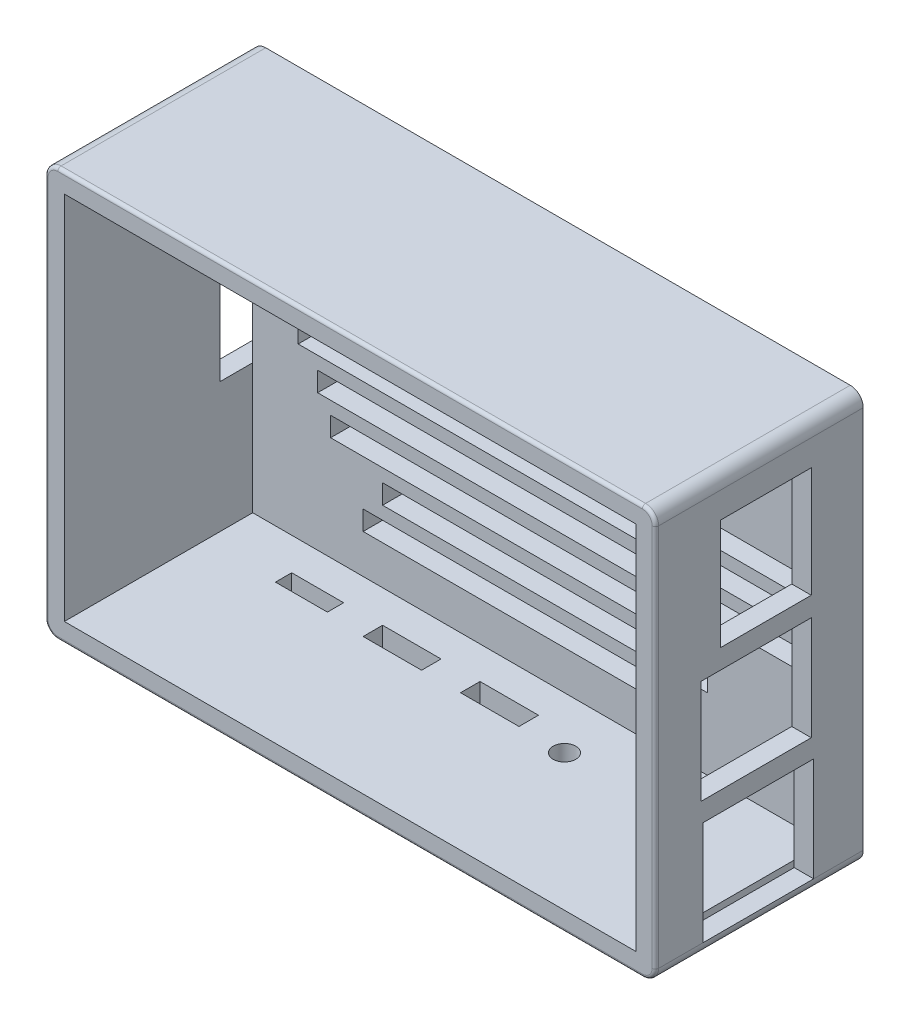
from build123d import *

# Parameters (mm, degrees)
SKETCH1_W             = 94
SKETCH1_H             = 63
BOSS_EXTRUDE1_DEPTH   = 32
SHELL1_T              = 3
SKETCH2_W             = 8
SKETCH2_H             = 17
CUT_EXTRUDE1_DEPTH    = 3
SKETCH3_W             = 14
SKETCH3_H             = 17
CUT_EXTRUDE2_DEPTH    = 3
SKETCH4_W             = 17
SKETCH4_H             = 16
CUT_EXTRUDE4_DEPTH    = 3
SKETCH5_W             = 17
SKETCH5_H             = 16
CUT_EXTRUDE5_DEPTH    = 3
SKETCH6_R             = 1.75
CUT_EXTRUDE6_DEPTH    = 3
SKETCH7_W             = 9
SKETCH7_H             = 3
SKETCH7_W_2           = 8
SKETCH7_H_2           = 2.5
CUT_EXTRUDE7_DEPTH    = 3
SKETCH9_W             = 2.320192308
SKETCH9_H             = 0.284935898
CUT_EXTRUDE8_DEPTH    = 1
SKETCH11_W            = 0.237446581
SKETCH11_H            = 2.645833333
SKETCH11_W_2          = 0.237446582
CUT_EXTRUDE9_DEPTH    = 1
SKETCH14_W            = 50
SKETCH14_H            = 3
SKETCH14_W_2          = 60
SKETCH14_W_3          = 76
CUT_EXTRUDE11_DEPTH   = 10
FILLET1_R             = 2
FILLET2_R             = 0.5
IZIM1_W               = 88
IZIM1_H               = 57
KES_EKSTR_ZYON1_DEPTH = 10


with BuildPart() as part:
    # Sketch1 → Boss-Extrude1 (new body)
    with BuildSketch(Plane.XY):
        with Locations((47, 31.5)):
            Rectangle(SKETCH1_W, SKETCH1_H)
    extrude(amount=BOSS_EXTRUDE1_DEPTH)

    # Shell1 (no face opened: a closed hollow body)
    add(offset(amount=-SHELL1_T, mode=Mode.PRIVATE), mode=Mode.SUBTRACT)

    # Sketch2 → Cut-Extrude1 (cut)
    with BuildSketch(Plane.ZY):
        with Locations((4, 31.5)):
            Rectangle(SKETCH2_W, SKETCH2_H)
    extrude(amount=-CUT_EXTRUDE1_DEPTH, mode=Mode.SUBTRACT)

    # Sketch3 → Cut-Extrude2 (cut)
    with BuildSketch(Plane(origin=(94, 0, 0), x_dir=(0, 0, -1), z_dir=(1, 0, 0))):
        with Locations((-15, 48.5)):
            Rectangle(SKETCH3_W, SKETCH3_H)
    extrude(amount=-CUT_EXTRUDE2_DEPTH, mode=Mode.SUBTRACT)

    # Sketch4 → Cut-Extrude4 (cut)
    with BuildSketch(Plane(origin=(94, 0, 0), x_dir=(0, 0, -1), z_dir=(1, 0, 0))):
        with Locations((-16.5, 29)):
            Rectangle(SKETCH4_W, SKETCH4_H)
    extrude(amount=-CUT_EXTRUDE4_DEPTH, mode=Mode.SUBTRACT)

    # Sketch5 → Cut-Extrude5 (cut)
    with BuildSketch(Plane(origin=(94, 0, 0), x_dir=(0, 0, -1), z_dir=(1, 0, 0))):
        with Locations((-16.132814298, 10)):
            Rectangle(SKETCH5_W, SKETCH5_H)
    extrude(amount=-CUT_EXTRUDE5_DEPTH, mode=Mode.SUBTRACT)

    # Sketch6 → Cut-Extrude6 (cut)
    with BuildSketch(Plane(origin=(0, 0, 0), x_dir=(-1, 0, 0), z_dir=(0, -1, 0))):
        with Locations(Location((-59, -11, 0), (0, 0, 90))):
            Circle(SKETCH6_R)
    extrude(amount=-CUT_EXTRUDE6_DEPTH, mode=Mode.SUBTRACT)

    # Sketch7 → Cut-Extrude7 (cut)
    with BuildSketch(Plane(origin=(0, 0, 0), x_dir=(-1, 0, 0), z_dir=(0, -1, 0))):
        with Locations((-47.5, -9.5)):
            Rectangle(SKETCH7_W, SKETCH7_H)
        with Locations((-32.5, -9.5)):
            Rectangle(SKETCH7_W, SKETCH7_H)
        with Locations((-18, -9.25)):
            Rectangle(SKETCH7_W_2, SKETCH7_H_2)
    extrude(amount=-CUT_EXTRUDE7_DEPTH, mode=Mode.SUBTRACT)

    # Sketch9 → Cut-Extrude8 (cut)
    # profile 1 of 8: a face of its own
    with BuildSketch(Plane.XY.offset(32)):
        with BuildLine():
            Line((79.592407853, 36.364576199), (79.401602564, 36.61389511))
            add(Edge.make_bspline(
                [(79.401602564, 36.61389511), (79.422798837, 36.631680451), (79.46490561, 36.667011349), (79.524032768, 36.723852197), (79.579427684, 36.783090116), (79.631354246, 36.844702462), (79.677996598, 36.909798235), (79.721785384, 36.976800531), (79.761035404, 37.046830186), (79.808626827, 37.143669259), (79.85828941, 37.270349808), (79.899930199, 37.42982084), (79.92643798, 37.596291622), (79.929308943, 37.709863731), (79.930769231, 37.767631087)],
                knots=[0, 0, 0, 0, 0.757959112, 1.505699292, 2.245454638, 2.979532153, 3.711538275, 4.438200793, 5.171680507, 5.909471876, 7.393775596, 8.890124382, 10.418191784, 12, 12, 12, 12], degree=3))
            add(Edge.make_bspline(
                [(79.930769231, 37.767631087), (79.930401126, 37.799456265), (79.929668331, 37.862811252), (79.920068742, 37.956840934), (79.906421017, 38.049292881), (79.886663101, 38.139823299), (79.860940087, 38.228252435), (79.830773858, 38.315253604), (79.793235048, 38.399802163), (79.751778443, 38.482915634), (79.704940099, 38.562540242), (79.653867717, 38.637894764), (79.599062564, 38.708634942), (79.54066611, 38.774956797), (79.477952603, 38.836132968), (79.411659795, 38.893143893), (79.340989768, 38.944962102), (79.267267879, 38.992860937), (79.190385773, 39.035482334), (79.1108271, 39.072287973), (79.028896043, 39.103833466), (78.944424761, 39.129026049), (78.857745669, 39.148897012), (78.768674814, 39.162624777), (78.677385087, 39.17213801), (78.615509579, 39.172864063), (78.584319912, 39.173230045)],
                knots=[0, 0, 0, 0, 1.055000685, 2.100209969, 3.131349012, 4.153242145, 5.170189196, 6.184191144, 7.204341339, 8.235672124, 9.263040994, 10.265373269, 11.252624173, 12.22887325, 13.193405896, 14.155809299, 15.126090485, 16.097288279, 17.069732292, 18.038585918, 19.002221264, 19.978698174, 20.959418239, 21.948869816, 22.966084182, 24, 24, 24, 24], degree=3))
            add(Edge.make_bspline(
                [(78.584319912, 39.173230045), (78.537392215, 39.172085395), (78.445255905, 39.169838027), (78.310299709, 39.149837038), (78.181013097, 39.119443134), (78.058204241, 39.073890432), (77.940358801, 39.017721007), (77.829470699, 38.946745595), (77.723864244, 38.864543451), (77.626035284, 38.769951656), (77.536669262, 38.666169237), (77.457974091, 38.554819346), (77.392374162, 38.436179314), (77.337785982, 38.311559085), (77.295824522, 38.179999681), (77.26628421, 38.041737682), (77.247014518, 37.897073801), (77.245169672, 37.798222988), (77.244230769, 37.747914541)],
                knots=[0, 0, 0, 0, 1.029171465, 2.020641659, 2.987623507, 3.938342917, 4.889210282, 5.84687017, 6.821220943, 7.821438502, 8.827599549, 9.822697543, 10.807740252, 11.797342354, 12.80366471, 13.83203677, 14.896651826, 16, 16, 16, 16], degree=3))
            add(Edge.make_bspline(
                [(77.244230769, 37.747914541), (77.245762734, 37.692485673), (77.248778006, 37.583388401), (77.274322468, 37.423397406), (77.315740722, 37.270239247), (77.373705266, 37.123905686), (77.449057348, 36.984809257), (77.540404709, 36.852732287), (77.648616268, 36.727563291), (77.731241677, 36.652296485), (77.773397436, 36.61389511)],
                knots=[0, 0, 0, 0, 1.028121516, 2.023589091, 2.998037872, 3.967518031, 4.937445131, 5.927275754, 6.942489185, 8, 8, 8, 8], degree=3))
            Line((77.773397436, 36.61389511), (77.5845002, 36.364576199))
            add(Edge.make_bspline(
                [(77.5845002, 36.364576199), (77.558611703, 36.384640458), (77.506958714, 36.424672869), (77.434141462, 36.489495894), (77.365646064, 36.557781681), (77.302039415, 36.630046279), (77.241993661, 36.705425405), (77.187521789, 36.785246822), (77.136964496, 36.868131861), (77.091284016, 36.95456309), (77.050326453, 37.044256744), (77.015748946, 37.13711948), (76.985534654, 37.232364561), (76.960842027, 37.330039952), (76.941538282, 37.430471959), (76.928641156, 37.533315999), (76.919803267, 37.638789163), (76.91899788, 37.709946769), (76.918589744, 37.746006488)],
                knots=[0, 0, 0, 0, 0.986756325, 1.968786143, 2.935506311, 3.899499537, 4.868307269, 5.8376204, 6.809456583, 7.792545619, 8.781780509, 9.778496008, 10.776623214, 11.79151764, 12.812666265, 13.856269958, 14.913646641, 16, 16, 16, 16], degree=3))
            add(Edge.make_bspline(
                [(76.918589744, 37.746006488), (76.918827408, 37.780154671), (76.919297361, 37.847678476), (76.926910255, 37.947372344), (76.937296803, 38.044427178), (76.952936064, 38.138565588), (76.971391287, 38.230301294), (76.996130213, 38.318802682), (77.023842671, 38.404940622), (77.056413623, 38.488369046), (77.093167589, 38.569158916), (77.134707074, 38.647049659), (77.180682766, 38.722005452), (77.23008124, 38.794763226), (77.284489221, 38.864248177), (77.343151096, 38.931062447), (77.405869149, 38.995580693), (77.451094623, 39.035497414), (77.473833133, 39.055566784)],
                knots=[0, 0, 0, 0, 1.114604814, 2.203992996, 3.262667896, 4.300477797, 5.318619304, 6.316056647, 7.298880507, 8.271930387, 9.238335007, 10.195173496, 11.151986948, 12.108099108, 13.064862484, 14.031167946, 15.010108607, 16, 16, 16, 16], degree=3))
            add(Edge.make_bspline(
                [(77.473833133, 39.055566784), (77.513331212, 39.087711975), (77.591850513, 39.151614272), (77.719109939, 39.233371142), (77.851977528, 39.303354996), (77.991151321, 39.359938867), (78.136319022, 39.404173632), (78.28755381, 39.434818002), (78.444714444, 39.454731243), (78.551609245, 39.457008433), (78.605944511, 39.458165943)],
                knots=[0, 0, 0, 0, 0.994628077, 1.977248131, 2.950237994, 3.925870899, 4.908910175, 5.911660606, 6.938484602, 8, 8, 8, 8], degree=3))
            add(Edge.make_bspline(
                [(78.605944511, 39.458165943), (78.663051712, 39.45674885), (78.775406564, 39.453960809), (78.94033561, 39.43046897), (79.098121922, 39.392219718), (79.249372626, 39.339550243), (79.393222321, 39.270065123), (79.530278547, 39.185947766), (79.660429392, 39.086376549), (79.782010866, 38.972601991), (79.893168603, 38.847802191), (79.990965005, 38.7141647), (80.072351404, 38.571940624), (80.140383692, 38.422699551), (80.19267544, 38.265323221), (80.229281549, 38.100147603), (80.252066361, 37.927483013), (80.254946728, 37.809679242), (80.256410256, 37.749822594)],
                knots=[0, 0, 0, 0, 1.032901378, 2.032168977, 3.007206631, 3.966850309, 4.924221947, 5.891988639, 6.871730993, 7.884084801, 8.900290346, 9.89161143, 10.874607481, 11.860025555, 12.854717796, 13.869097222, 14.917278314, 16, 16, 16, 16], degree=3))
            add(Edge.make_bspline(
                [(80.256410256, 37.749822594), (80.255973215, 37.713342251), (80.255108136, 37.641133087), (80.246661398, 37.534315646), (80.232605758, 37.430314869), (80.213348582, 37.328879244), (80.189745739, 37.229640947), (80.158847794, 37.133618086), (80.122967705, 37.040287782), (80.082697452, 36.949580136), (80.036659325, 36.862482019), (79.986657094, 36.779009281), (79.931536539, 36.70016887), (79.873119948, 36.624477791), (79.809222157, 36.55364009), (79.741924047, 36.48563266), (79.669228646, 36.422804733), (79.618061659, 36.384021241), (79.592407853, 36.364576199)],
                knots=[0, 0, 0, 0, 1.096705196, 2.170817488, 3.219277236, 4.250701065, 5.274195539, 6.284202015, 7.28098643, 8.279664616, 9.266225751, 10.241373748, 11.203306326, 12.157093976, 13.114198862, 14.069774147, 15.032234603, 16, 16, 16, 16], degree=3))
        make_face()
    # profile 2 of 8: a face of its own
    with BuildSketch(Plane.XY.offset(32)):
        with BuildLine():
            Line((79.320192308, 33.433806969), (77, 33.433806969))
            Line((77, 33.433806969), (77, 33.718742866))
            Line((77, 33.718742866), (77.401327123, 33.718742866))
            add(Edge.make_bspline(
                [(77.401327123, 33.718742866), (77.364995688, 33.75086605), (77.294094435, 33.813554849), (77.201743879, 33.918239121), (77.124780832, 34.028742835), (77.063197788, 34.145439663), (77.01658663, 34.267980451), (76.983808313, 34.396015744), (76.962470523, 34.529374903), (76.960362919, 34.62032125), (76.959294872, 34.666409132)],
                knots=[0, 0, 0, 0, 1.074295371, 2.096500925, 3.086030275, 4.053105238, 5.014108356, 5.985331429, 6.979048527, 8, 8, 8, 8], degree=3))
            add(Edge.make_bspline(
                [(76.959294872, 34.666409132), (76.960407182, 34.70738303), (76.962600707, 34.788185371), (76.979623451, 34.907045862), (77.006946428, 35.021435457), (77.044992597, 35.13142706), (77.095199127, 35.236275388), (77.155955963, 35.336571232), (77.227599005, 35.432548666), (77.309821196, 35.5223824), (77.399031733, 35.605211329), (77.494459932, 35.677678276), (77.594795087, 35.739096373), (77.700008999, 35.789571049), (77.810024757, 35.828631), (77.924766887, 35.855806157), (78.044044465, 35.872810557), (78.12526995, 35.875002971), (78.16645633, 35.876114661)],
                knots=[0, 0, 0, 0, 1.034036272, 2.039165313, 3.024406509, 3.999331371, 4.971254918, 5.953351348, 6.95522652, 7.989525907, 9.023492927, 10.024309745, 11.009187477, 11.988246066, 12.964946762, 13.950187958, 14.960617622, 16, 16, 16, 16], degree=3))
            add(Edge.make_bspline(
                [(78.16645633, 35.876114661), (78.206791433, 35.874978314), (78.286531756, 35.872731817), (78.403803519, 35.855988109), (78.516768542, 35.827853322), (78.625008361, 35.788294483), (78.728958893, 35.737792967), (78.827806828, 35.675318617), (78.92306426, 35.602877784), (79.011676453, 35.519163623), (79.093231565, 35.428523599), (79.165048714, 35.33200918), (79.225649774, 35.230823806), (79.274912545, 35.124764585), (79.314059741, 35.014582511), (79.341349107, 34.899440589), (79.357390885, 34.779862438), (79.359717355, 34.69868263), (79.360897436, 34.657504885)],
                knots=[0, 0, 0, 0, 1.02050356, 2.017480486, 2.990790918, 3.96161403, 4.928589988, 5.909588639, 6.91611943, 7.952353252, 8.989586576, 9.99823133, 10.991940466, 11.968822692, 12.952985106, 13.945868367, 14.958059758, 16, 16, 16, 16], degree=3))
            add(Edge.make_bspline(
                [(79.360897436, 34.657504885), (79.35959954, 34.610150313), (79.357054429, 34.517290231), (79.335648743, 34.381289209), (79.299929904, 34.252512878), (79.250839162, 34.130218955), (79.186088065, 34.014881847), (79.103669958, 33.907921046), (79.005467682, 33.807183259), (78.929818802, 33.748796176), (78.890880409, 33.718742866)],
                knots=[0, 0, 0, 0, 1.03879612, 2.037030165, 3.012306674, 3.966139504, 4.922386257, 5.905048148, 6.921675258, 8, 8, 8, 8], degree=3))
            Line((78.890880409, 33.718742866), (79.320192308, 33.718742866))
            Line((79.320192308, 33.718742866), (79.320192308, 33.433806969))
        make_face()
        with BuildLine():
            add(Edge.make_bspline(
                [(79.075961538, 34.653688779), (79.074479612, 34.695339668), (79.071554524, 34.777551898), (79.048718337, 34.898241451), (79.010723893, 35.013734268), (78.958757765, 35.123444511), (78.893429501, 35.225669681), (78.814353247, 35.316942945), (78.724043657, 35.398356292), (78.621741454, 35.465667444), (78.513319241, 35.522417441), (78.399120862, 35.561333849), (78.282314515, 35.587230091), (78.203058982, 35.589859112), (78.163276242, 35.591178763)],
                knots=[0, 0, 0, 0, 1.031093775, 2.03521511, 3.029845951, 4.035119871, 5.034286494, 6.024708811, 7.017619509, 8.03559408, 9.050082311, 10.039808432, 11.016071318, 12, 12, 12, 12], degree=3))
            add(Edge.make_bspline(
                [(78.163276242, 35.591178763), (78.123739082, 35.589471444), (78.044819734, 35.586063497), (77.927666339, 35.562016456), (77.813927693, 35.520351084), (77.704003595, 35.464896412), (77.601491403, 35.396075419), (77.509415819, 35.315337749), (77.430022437, 35.222900584), (77.363570151, 35.120453679), (77.31007922, 35.01120177), (77.272360445, 34.89625621), (77.248543069, 34.777636627), (77.245673038, 34.6968369), (77.244230769, 34.65623285)],
                knots=[0, 0, 0, 0, 0.979154363, 1.954470772, 2.947816011, 3.971783346, 4.997163654, 5.998045606, 6.995988793, 8.00538986, 9.015323546, 10.000094788, 10.994993517, 12, 12, 12, 12], degree=3))
            add(Edge.make_bspline(
                [(77.244230769, 34.65623285), (77.245714042, 34.615001481), (77.248656622, 34.53320494), (77.271874718, 34.412231326), (77.309396751, 34.294652065), (77.36210666, 34.182216186), (77.427132861, 34.077551449), (77.503594937, 33.983732822), (77.591774751, 33.903622309), (77.689464359, 33.836464479), (77.796058113, 33.78341316), (77.910031357, 33.745995378), (78.030488427, 33.723013869), (78.112927573, 33.720186219), (78.155008013, 33.718742866)],
                knots=[0, 0, 0, 0, 1.017484689, 2.018529338, 3.030031036, 4.058138743, 5.076350332, 6.065651025, 7.036469986, 8.00785331, 8.984076697, 9.96571663, 10.961615403, 12, 12, 12, 12], degree=3))
            add(Edge.make_bspline(
                [(78.155008013, 33.718742866), (78.187064461, 33.719613425), (78.250161695, 33.721326961), (78.34280612, 33.734417353), (78.431463925, 33.75524147), (78.516232148, 33.784581448), (78.596628012, 33.823136852), (78.67328171, 33.869589193), (78.745479223, 33.924891278), (78.813129118, 33.987360122), (78.874523952, 34.056508928), (78.928636843, 34.130039722), (78.974431239, 34.2077675), (79.011078734, 34.289637702), (79.040934529, 34.375019758), (79.060653765, 34.464732039), (79.074237276, 34.557870409), (79.075380733, 34.621413033), (79.075961538, 34.653688779)],
                knots=[0, 0, 0, 0, 1.050062701, 2.066855696, 3.059271411, 4.030305351, 4.999747758, 5.975466543, 6.961907836, 7.974539719, 8.98812422, 9.98710676, 10.961662635, 11.93785114, 12.922015094, 13.919620009, 14.94329489, 16, 16, 16, 16], degree=3))
        make_face(mode=Mode.SUBTRACT)
    # profile 3 of 8: a face of its own
    with BuildSketch(Plane.XY.offset(32)):
        with BuildLine():
            Line((79.320192308, 32.782524917), (79.320192308, 32.49758902))
            Line((79.320192308, 32.49758902), (78.901692708, 32.49758902))
            add(Edge.make_bspline(
                [(78.901692708, 32.49758902), (78.939650035, 32.467165594), (79.013307553, 32.408127874), (79.11011836, 32.3098078), (79.189897243, 32.205900119), (79.253491399, 32.097041159), (79.301430838, 31.983083142), (79.33605279, 31.864720712), (79.356812599, 31.741245228), (79.359525165, 31.657276061), (79.360897436, 31.614796552)],
                knots=[0, 0, 0, 0, 1.12780773, 2.188550248, 3.19190651, 4.159438251, 5.104880172, 6.052711206, 7.014878035, 8, 8, 8, 8], degree=3))
            add(Edge.make_bspline(
                [(79.360897436, 31.614796552), (79.359311939, 31.571862065), (79.356208739, 31.487828919), (79.331733941, 31.365458896), (79.289686849, 31.25106759), (79.232671944, 31.144905591), (79.161388453, 31.049412476), (79.077897152, 30.966307542), (78.982598051, 30.896985598), (78.893915897, 30.850576457), (78.815281557, 30.819977568), (78.747928028, 30.800717955), (78.67289119, 30.784360928), (78.590395887, 30.770180807), (78.499864703, 30.760585823), (78.401668573, 30.753018182), (78.295839357, 30.74759465), (78.222645059, 30.747379469), (78.184900841, 30.747268507)],
                knots=[0, 0, 0, 0, 1.235764744, 2.418689688, 3.575570385, 4.733739044, 5.876600945, 6.994686206, 8.113221397, 9.257403329, 9.866223892, 10.540462211, 11.272173464, 12.077110251, 12.949508505, 13.892531187, 14.913238277, 16, 16, 16, 16], degree=3))
            Line((78.184900841, 30.747268507), (77, 30.747268507))
            Line((77, 30.747268507), (77, 31.032204404))
            Line((77, 31.032204404), (78.09140625, 31.032204404))
            add(Edge.make_bspline(
                [(78.09140625, 31.032204404), (78.122995182, 31.032379672), (78.183419433, 31.032714928), (78.269932762, 31.033772336), (78.348388443, 31.036321232), (78.418598912, 31.039902916), (78.48049675, 31.045145322), (78.534208022, 31.050608709), (78.579664536, 31.057289795), (78.607028575, 31.063243295), (78.619300881, 31.065913339)],
                knots=[0, 0, 0, 0, 1.430800155, 2.736877192, 3.918605307, 4.986035426, 5.920637409, 6.731861385, 7.431261377, 8, 8, 8, 8], degree=3))
            add(Edge.make_bspline(
                [(78.619300881, 31.065913339), (78.655324599, 31.075552214), (78.72465911, 31.094104066), (78.818706559, 31.139945608), (78.898714915, 31.197834186), (78.964189512, 31.268498664), (79.015144486, 31.351256468), (79.05049943, 31.445877948), (79.072612189, 31.55145), (79.074813944, 31.625703619), (79.075961538, 31.664405927)],
                knots=[0, 0, 0, 0, 1.084156227, 2.086665306, 3.027808233, 3.945421172, 4.874247719, 5.839848303, 6.874090471, 8, 8, 8, 8], degree=3))
            add(Edge.make_bspline(
                [(79.075961538, 31.664405927), (79.075529895, 31.687327406), (79.074675684, 31.732688421), (79.066099662, 31.799951868), (79.052085413, 31.86520175), (79.033122211, 31.929066782), (79.007317289, 31.990192218), (78.977447743, 32.050364303), (78.940871435, 32.107861022), (78.899887182, 32.163769838), (78.85421131, 32.215723112), (78.806720377, 32.264756865), (78.755415002, 32.307838312), (78.702111953, 32.346944432), (78.645739749, 32.380660736), (78.586901169, 32.41010292), (78.525503092, 32.435081034), (78.482890095, 32.447493284), (78.46156851, 32.453703804)],
                knots=[0, 0, 0, 0, 1.02388931, 2.02625049, 3.024079426, 4.004119353, 4.998163158, 5.985366248, 7.002659681, 8.039138713, 9.080111048, 10.09169763, 11.086418407, 12.069932368, 13.043171485, 14.017654831, 15.008125612, 16, 16, 16, 16], degree=3))
            add(Edge.make_bspline(
                [(78.46156851, 32.453703804), (78.445915575, 32.457277628), (78.411839956, 32.465057656), (78.355919662, 32.473460683), (78.291231327, 32.481087555), (78.21785044, 32.487471082), (78.135520082, 32.49137671), (78.044591857, 32.495635198), (77.944703193, 32.497185561), (77.875160086, 32.497450767), (77.838907252, 32.49758902)],
                knots=[0, 0, 0, 0, 0.615963638, 1.340920617, 2.168419149, 3.115676021, 4.16674242, 5.331190069, 6.6087489, 8, 8, 8, 8], degree=3))
            Line((77.838907252, 32.49758902), (77, 32.49758902))
            Line((77, 32.49758902), (77, 32.782524917))
            Line((77, 32.782524917), (79.320192308, 32.782524917))
        make_face()
    # profile 4 of 8: a face of its own
    with BuildSketch(Plane.XY.offset(32)):
        with BuildLine():
            Line((79.320192308, 27.73508902), (77, 27.73508902))
            Line((77, 27.73508902), (77, 28.020024917))
            Line((77, 28.020024917), (77.401327123, 28.020024917))
            add(Edge.make_bspline(
                [(77.401327123, 28.020024917), (77.364995688, 28.052148102), (77.294094435, 28.1148369), (77.201743879, 28.219521173), (77.124780832, 28.330024887), (77.063197788, 28.446721714), (77.01658663, 28.569262502), (76.983808313, 28.697297795), (76.962470523, 28.830656954), (76.960362919, 28.921603301), (76.959294872, 28.967691183)],
                knots=[0, 0, 0, 0, 1.074295371, 2.096500925, 3.086030275, 4.053105238, 5.014108356, 5.985331429, 6.979048527, 8, 8, 8, 8], degree=3))
            add(Edge.make_bspline(
                [(76.959294872, 28.967691183), (76.960407182, 29.008665081), (76.962600707, 29.089467423), (76.979623451, 29.208327913), (77.006946428, 29.322717508), (77.044992597, 29.432709111), (77.095199127, 29.537557439), (77.155955963, 29.637853283), (77.227599005, 29.733830718), (77.309821196, 29.823664452), (77.399031733, 29.90649338), (77.494459932, 29.978960327), (77.594795087, 30.040378424), (77.700008999, 30.0908531), (77.810024757, 30.129913051), (77.924766887, 30.157088208), (78.044044465, 30.174092608), (78.12526995, 30.176285022), (78.16645633, 30.177396712)],
                knots=[0, 0, 0, 0, 1.034036272, 2.039165313, 3.024406509, 3.999331371, 4.971254918, 5.953351348, 6.95522652, 7.989525907, 9.023492927, 10.024309745, 11.009187477, 11.988246066, 12.964946762, 13.950187958, 14.960617622, 16, 16, 16, 16], degree=3))
            add(Edge.make_bspline(
                [(78.16645633, 30.177396712), (78.206791433, 30.176260365), (78.286531756, 30.174013868), (78.403803519, 30.15727016), (78.516768542, 30.129135373), (78.625008361, 30.089576534), (78.728958893, 30.039075018), (78.827806828, 29.976600669), (78.92306426, 29.904159835), (79.011676453, 29.820445675), (79.093231565, 29.72980565), (79.165048714, 29.633291232), (79.225649774, 29.532105857), (79.274912545, 29.426046637), (79.314059741, 29.315864562), (79.341349107, 29.20072264), (79.357390885, 29.081144489), (79.359717355, 28.999964681), (79.360897436, 28.958786937)],
                knots=[0, 0, 0, 0, 1.02050356, 2.017480486, 2.990790918, 3.96161403, 4.928589988, 5.909588639, 6.91611943, 7.952353252, 8.989586576, 9.99823133, 10.991940466, 11.968822692, 12.952985106, 13.945868367, 14.958059758, 16, 16, 16, 16], degree=3))
            add(Edge.make_bspline(
                [(79.360897436, 28.958786937), (79.35959954, 28.911432364), (79.357054429, 28.818572282), (79.335648743, 28.68257126), (79.299929904, 28.55379493), (79.250839162, 28.431501006), (79.186088065, 28.316163898), (79.103669958, 28.209203097), (79.005467682, 28.10846531), (78.929818802, 28.050078227), (78.890880409, 28.020024917)],
                knots=[0, 0, 0, 0, 1.03879612, 2.037030165, 3.012306674, 3.966139504, 4.922386257, 5.905048148, 6.921675258, 8, 8, 8, 8], degree=3))
            Line((78.890880409, 28.020024917), (79.320192308, 28.020024917))
            Line((79.320192308, 28.020024917), (79.320192308, 27.73508902))
        make_face()
        with BuildLine():
            add(Edge.make_bspline(
                [(79.075961538, 28.954970831), (79.074479612, 28.996621719), (79.071554524, 29.078833949), (79.048718337, 29.199523503), (79.010723893, 29.315016319), (78.958757765, 29.424726562), (78.893429501, 29.526951732), (78.814353247, 29.618224996), (78.724043657, 29.699638344), (78.621741454, 29.766949495), (78.513319241, 29.823699492), (78.399120862, 29.862615901), (78.282314515, 29.888512142), (78.203058982, 29.891141163), (78.163276242, 29.892460815)],
                knots=[0, 0, 0, 0, 1.031093775, 2.03521511, 3.029845951, 4.035119871, 5.034286494, 6.024708811, 7.017619509, 8.03559408, 9.050082311, 10.039808432, 11.016071318, 12, 12, 12, 12], degree=3))
            add(Edge.make_bspline(
                [(78.163276242, 29.892460815), (78.123739082, 29.890753495), (78.044819734, 29.887345549), (77.927666339, 29.863298507), (77.813927693, 29.821633136), (77.704003595, 29.766178463), (77.601491403, 29.69735747), (77.509415819, 29.616619801), (77.430022437, 29.524182636), (77.363570151, 29.421735731), (77.31007922, 29.312483821), (77.272360445, 29.197538261), (77.248543069, 29.078918679), (77.245673038, 28.998118951), (77.244230769, 28.957514901)],
                knots=[0, 0, 0, 0, 0.979154363, 1.954470772, 2.947816011, 3.971783346, 4.997163654, 5.998045606, 6.995988793, 8.00538986, 9.015323546, 10.000094788, 10.994993517, 12, 12, 12, 12], degree=3))
            add(Edge.make_bspline(
                [(77.244230769, 28.957514901), (77.245714042, 28.916283532), (77.248656622, 28.834486992), (77.271874718, 28.713513377), (77.309396751, 28.595934116), (77.36210666, 28.483498238), (77.427132861, 28.3788335), (77.503594937, 28.285014874), (77.591774751, 28.20490436), (77.689464359, 28.137746531), (77.796058113, 28.084695211), (77.910031357, 28.047277429), (78.030488427, 28.024295921), (78.112927573, 28.02146827), (78.155008013, 28.020024917)],
                knots=[0, 0, 0, 0, 1.017484689, 2.018529338, 3.030031036, 4.058138743, 5.076350332, 6.065651025, 7.036469986, 8.00785331, 8.984076697, 9.96571663, 10.961615403, 12, 12, 12, 12], degree=3))
            add(Edge.make_bspline(
                [(78.155008013, 28.020024917), (78.187064461, 28.020895476), (78.250161695, 28.022609012), (78.34280612, 28.035699404), (78.431463925, 28.056523521), (78.516232148, 28.085863499), (78.596628012, 28.124418903), (78.67328171, 28.170871244), (78.745479223, 28.226173329), (78.813129118, 28.288642174), (78.874523952, 28.35779098), (78.928636843, 28.431321773), (78.974431239, 28.509049551), (79.011078734, 28.590919753), (79.040934529, 28.676301809), (79.060653765, 28.76601409), (79.074237276, 28.85915246), (79.075380733, 28.922695085), (79.075961538, 28.954970831)],
                knots=[0, 0, 0, 0, 1.050062701, 2.066855696, 3.059271411, 4.030305351, 4.999747758, 5.975466543, 6.961907836, 7.974539719, 8.98812422, 9.98710676, 10.961662635, 11.93785114, 12.922015094, 13.919620009, 14.94329489, 16, 16, 16, 16], degree=3))
        make_face(mode=Mode.SUBTRACT)
    # profile 5 of 8: a face of its own
    with BuildSketch(Plane.XY.offset(32)):
        Polygon((80.175, 27.002396712), (80.175, 26.717460815), (78.965930489, 26.717460815), (80.175, 25.39390813), (80.175, 24.987492866), (78.750320513, 26.547644108), (77, 24.865377481), (77, 25.245080005), (78.532166466, 26.717460815), (77, 26.717460815), (77, 27.002396712), align=None)
    # profile 6 of 8: a face of its own
    with BuildSketch(Plane.XY.offset(32)):
        with BuildLine():
            add(Edge.make_bspline(
                [(80.297115385, 24.378187978), (80.296291631, 24.360509523), (80.294678565, 24.325891711), (80.280975474, 24.275781599), (80.257393594, 24.230198762), (80.226783738, 24.189164526), (80.189305024, 24.15514903), (80.146720919, 24.13075811), (80.100361492, 24.11518702), (80.068059231, 24.113295616), (80.05161258, 24.11233261)],
                knots=[0, 0, 0, 0, 1.054986045, 2.065865298, 3.074122704, 4.105114675, 5.109626121, 6.074217918, 7.019490725, 8, 8, 8, 8], degree=3))
            add(Edge.make_bspline(
                [(80.05161258, 24.11233261), (80.035592833, 24.113317159), (80.003923688, 24.115263496), (79.958368075, 24.130746599), (79.916376945, 24.155353519), (79.878971504, 24.189141886), (79.848379332, 24.230204742), (79.82479278, 24.275780017), (79.811090923, 24.325892127), (79.809477686, 24.360509663), (79.808653846, 24.378187978)],
                knots=[0, 0, 0, 0, 0.961106377, 1.899993565, 2.859409042, 3.870007927, 4.90724781, 5.921615355, 6.938620636, 8, 8, 8, 8], degree=3))
            add(Edge.make_bspline(
                [(79.808653846, 24.378187978), (79.809451227, 24.395663254), (79.811003226, 24.429676594), (79.824956711, 24.478865329), (79.848328041, 24.523714721), (79.879394858, 24.564077894), (79.916128223, 24.598536163), (79.958399793, 24.623052291), (80.003915612, 24.638576791), (80.03559012, 24.640517549), (80.05161258, 24.641499276)],
                knots=[0, 0, 0, 0, 1.055304112, 2.054011575, 3.063363921, 4.096942562, 5.122536081, 6.088009498, 7.032825006, 8, 8, 8, 8], degree=3))
            add(Edge.make_bspline(
                [(80.05161258, 24.641499276), (80.068062047, 24.640539197), (80.100369838, 24.638653541), (80.146688658, 24.623040241), (80.189555867, 24.598743174), (80.226360691, 24.564055629), (80.257444772, 24.52372055), (80.280811588, 24.478863811), (80.294766253, 24.429676997), (80.296318087, 24.39566339), (80.297115385, 24.378187978)],
                knots=[0, 0, 0, 0, 0.986662878, 1.937868148, 2.908513651, 3.927890639, 4.955204348, 5.958438607, 6.951092507, 8, 8, 8, 8], degree=3))
        make_face()
    # profile 7 of 8: a face of its own
    with BuildSketch(Plane.XY.offset(32)):
        with Locations((78.160096154, 24.376915943)):
            Rectangle(SKETCH9_W, SKETCH9_H)
    # profile 8 of 8: a face of its own
    with BuildSketch(Plane.XY.offset(32)):
        Polygon((80.256410256, 23.298230045), (80.256410256, 23.013294148), (79.320192308, 23.013294148), (79.320192308, 22.606242866), (79.03525641, 22.606242866), (79.03525641, 23.013294148), (77, 23.013294148), (77, 23.298230045), (79.03525641, 23.298230045), (79.03525641, 23.705281328), (79.320192308, 23.705281328), (79.320192308, 23.298230045), align=None)
    extrude(amount=-CUT_EXTRUDE8_DEPTH, mode=Mode.SUBTRACT)

    # Sketch11 → Cut-Extrude9 (cut)
    # profile 1 of 14: a face of its own
    with BuildSketch(Plane.XZ):
        with BuildLine():
            Line((13.568376068, 2.645833333), (14.08726045, 2.645833333))
            add(Edge.make_bspline(
                [(14.08726045, 2.645833333), (14.122949647, 2.645794102), (14.191331733, 2.645718934), (14.289390138, 2.643439929), (14.378448686, 2.640395942), (14.458315343, 2.636176297), (14.529235845, 2.631189588), (14.59088928, 2.624195487), (14.643760254, 2.616892764), (14.675439534, 2.609468248), (14.689887153, 2.606082232)],
                knots=[0, 0, 0, 0, 1.415646017, 2.712440637, 3.8905458, 4.950247383, 5.884950622, 6.709939814, 7.411656543, 8, 8, 8, 8], degree=3))
            add(Edge.make_bspline(
                [(14.689887153, 2.606082232), (14.708176312, 2.601076353), (14.74432367, 2.591182553), (14.796409578, 2.571366226), (14.845965163, 2.547869589), (14.893160448, 2.521090777), (14.937415476, 2.489880857), (14.979390518, 2.455504967), (15.018715146, 2.417169436), (15.055168222, 2.375304234), (15.088645421, 2.330612171), (15.117469645, 2.28242608), (15.141605108, 2.231557059), (15.162305558, 2.178040491), (15.177204211, 2.121426972), (15.18842776, 2.062109874), (15.195551574, 2.000095555), (15.196233867, 1.957716964), (15.196581197, 1.936143663)],
                knots=[0, 0, 0, 0, 0.999701418, 1.975846123, 2.934577507, 3.890451536, 4.834027766, 5.787354733, 6.749476667, 7.726910423, 8.712836071, 9.690891519, 10.682875813, 11.679750201, 12.712814741, 13.765529915, 14.8625177, 16, 16, 16, 16], degree=3))
            add(Edge.make_bspline(
                [(15.196581197, 1.936143663), (15.19626262, 1.914389034), (15.195639302, 1.871824634), (15.188158182, 1.809554728), (15.178081192, 1.750047374), (15.162586396, 1.693434515), (15.142292346, 1.640052356), (15.118485853, 1.589085115), (15.089772113, 1.541399887), (15.0567787, 1.496823554), (15.020076007, 1.455314275), (14.979819321, 1.417172853), (14.936171166, 1.382622549), (14.889270256, 1.351585908), (14.838659358, 1.32478265), (14.785106064, 1.300775639), (14.728144888, 1.280613587), (14.688727631, 1.270007529), (14.668686565, 1.264615051)],
                knots=[0, 0, 0, 0, 1.121902311, 2.195077645, 3.232258892, 4.234102512, 5.217864754, 6.176164875, 7.132989551, 8.084763148, 9.034132444, 9.988522005, 10.94243251, 11.903244335, 12.886203696, 13.894208494, 14.929344452, 16, 16, 16, 16], degree=3))
            add(Edge.make_bspline(
                [(14.668686565, 1.264615051), (14.652110545, 1.261090059), (14.615783232, 1.253364835), (14.555955103, 1.244740585), (14.486297579, 1.237379422), (14.406905737, 1.23186011), (14.317850838, 1.227135129), (14.219084709, 1.223379487), (14.110413472, 1.221315847), (14.034613187, 1.221209415), (13.995037894, 1.221153846)],
                knots=[0, 0, 0, 0, 0.601384939, 1.31797006, 2.144135048, 3.087295005, 4.142315834, 5.309527816, 6.595305764, 8, 8, 8, 8], degree=3))
            Line((13.995037894, 1.221153846), (13.80582265, 1.221153846))
            Line((13.80582265, 1.221153846), (13.80582265, 0))
            Line((13.80582265, 0), (13.568376068, 0))
            Line((13.568376068, 0), (13.568376068, 2.645833333))
        make_face()
        with BuildLine():
            Line((13.80582265, 2.374465812), (13.80582265, 1.492521368))
            Line((13.80582265, 1.492521368), (14.269055489, 1.486691206))
            add(Edge.make_bspline(
                [(14.269055489, 1.486691206), (14.291673528, 1.486679516), (14.335337186, 1.486656949), (14.398410998, 1.489669589), (14.456928733, 1.493147372), (14.510710644, 1.49823941), (14.559780975, 1.505437027), (14.604221548, 1.512703043), (14.643687768, 1.523214835), (14.689875855, 1.537368584), (14.741343623, 1.56150812), (14.797335163, 1.59654643), (14.844786737, 1.641208632), (14.885848783, 1.69142491), (14.918434774, 1.747289132), (14.942289602, 1.807061483), (14.956305834, 1.870128965), (14.958185278, 1.913284879), (14.959134615, 1.935083634)],
                knots=[0, 0, 0, 0, 1.160613943, 2.240541288, 3.23993089, 4.169200891, 5.011653406, 5.7853311, 6.478053781, 7.106038997, 8.262395093, 9.384106736, 10.481365981, 11.59014053, 12.70357646, 13.786202915, 14.881775077, 16, 16, 16, 16], degree=3))
            add(Edge.make_bspline(
                [(14.959134615, 1.935083634), (14.958180115, 1.95635501), (14.956282686, 1.998639873), (14.942179741, 2.060611913), (14.918481153, 2.11975438), (14.885630037, 2.174918557), (14.845760254, 2.224954141), (14.79942087, 2.268419231), (14.746720964, 2.303360638), (14.697698789, 2.325913178), (14.654155036, 2.339683059), (14.616333256, 2.349317551), (14.573628996, 2.357009825), (14.526028354, 2.363238497), (14.473900271, 2.368570577), (14.416796902, 2.372188548), (14.354934564, 2.374306316), (14.311988478, 2.374411359), (14.289726062, 2.374465812)],
                knots=[0, 0, 0, 0, 1.120700087, 2.227813068, 3.331159281, 4.466773991, 5.599788987, 6.693661531, 7.80175334, 8.91857717, 9.525282508, 10.207424825, 10.974604443, 11.810962634, 12.737642355, 13.736264703, 14.826523623, 16, 16, 16, 16], degree=3))
            Line((14.289726062, 2.374465812), (13.80582265, 2.374465812))
        make_face(mode=Mode.SUBTRACT)
    # profile 2 of 14: a face of its own
    with BuildSketch(Plane.XZ):
        Polygon((15.569711538, 2.645833333), (15.81510834, 2.645833333), (16.332932692, 0.705449553), (17.103044037, 2.645833333), (17.137494992, 2.645833333), (17.89329594, 0.71869992), (18.413770366, 2.645833333), (18.656517094, 2.645833333), (17.943117321, 0), (17.909196381, 0), (17.113114316, 2.023596087), (16.307491987, 0), (16.273571047, 0), align=None)
    # profile 3 of 14: a face of its own
    with BuildSketch(Plane.XZ):
        with BuildLine():
            Line((19.131410256, 2.645833333), (19.660894932, 2.645833333))
            add(Edge.make_bspline(
                [(19.660894932, 2.645833333), (19.696228999, 2.645715718), (19.764074323, 2.645489883), (19.861269593, 2.644230645), (19.949585315, 2.64062146), (20.028975312, 2.637515566), (20.099438129, 2.631852015), (20.161189831, 2.626438907), (20.213946007, 2.619352866), (20.245881859, 2.612771981), (20.260341546, 2.609792334)],
                knots=[0, 0, 0, 0, 1.410062039, 2.707475311, 3.878576406, 4.937260626, 5.877586885, 6.699081471, 7.410979367, 8, 8, 8, 8], degree=3))
            add(Edge.make_bspline(
                [(20.260341546, 2.609792334), (20.279698935, 2.605009601), (20.318000766, 2.595546163), (20.373147542, 2.575543965), (20.425697061, 2.552396987), (20.475431035, 2.525210127), (20.522100354, 2.493781573), (20.56618622, 2.458653885), (20.607888683, 2.420019271), (20.645521225, 2.376903647), (20.681004913, 2.331670095), (20.710932029, 2.282757136), (20.736730023, 2.231608243), (20.75726964, 2.177703231), (20.773808346, 2.121564868), (20.785469848, 2.062684646), (20.792463306, 2.001330814), (20.793175304, 1.959482871), (20.793536325, 1.938263722)],
                knots=[0, 0, 0, 0, 1.027469482, 2.033020251, 3.019912614, 3.986113645, 4.951240523, 5.91722682, 6.890402269, 7.87763091, 8.8651537, 9.85103654, 10.82876324, 11.815024772, 12.821070561, 13.842952187, 14.906261191, 16, 16, 16, 16], degree=3))
            add(Edge.make_bspline(
                [(20.793536325, 1.938263722), (20.792425832, 1.903009804), (20.790258973, 1.834220278), (20.770056068, 1.73438854), (20.736963103, 1.641263284), (20.691361569, 1.554961766), (20.633289704, 1.477166219), (20.563496558, 1.408835339), (20.481943197, 1.351655167), (20.406023417, 1.312003345), (20.338959706, 1.286608705), (20.283749999, 1.268740744), (20.223525558, 1.254935567), (20.158863406, 1.242568087), (20.089494453, 1.233230794), (20.015584958, 1.226391999), (19.937082213, 1.222117808), (19.883153274, 1.221481292), (19.855410323, 1.221153846)],
                knots=[0, 0, 0, 0, 1.260483769, 2.459530307, 3.627416485, 4.787058657, 5.939039949, 7.08810263, 8.267026773, 9.491475466, 10.141966685, 10.831826277, 11.566392101, 12.351337768, 13.187381173, 14.07005841, 15.007169909, 16, 16, 16, 16], degree=3))
            Line((19.855410323, 1.221153846), (20.827457265, 0))
            Line((20.827457265, 0), (20.533829127, 0))
            Line((20.533829127, 0), (19.561782185, 1.221153846))
            Line((19.561782185, 1.221153846), (19.368856838, 1.221153846))
            Line((19.368856838, 1.221153846), (19.368856838, 0))
            Line((19.368856838, 0), (19.131410256, 0))
            Line((19.131410256, 0), (19.131410256, 2.645833333))
        make_face()
        with BuildLine():
            Line((19.368856838, 2.374465812), (19.368856838, 1.492521368))
            Line((19.368856838, 1.492521368), (19.853290264, 1.488811265))
            add(Edge.make_bspline(
                [(19.853290264, 1.488811265), (19.875908389, 1.488801258), (19.919748757, 1.488781863), (19.983173664, 1.491800968), (20.042228748, 1.4952355), (20.096688127, 1.500488875), (20.146576127, 1.507259238), (20.191867814, 1.515728161), (20.232637121, 1.525594899), (20.280185421, 1.540866366), (20.333280894, 1.565061392), (20.390983843, 1.600262691), (20.440122515, 1.644538156), (20.481637804, 1.6951669), (20.514997553, 1.750832398), (20.538516784, 1.810867391), (20.553441131, 1.873756277), (20.5552014, 1.916980204), (20.556089744, 1.938793737)],
                knots=[0, 0, 0, 0, 1.146690395, 2.22261258, 3.21895312, 4.145990853, 4.996080663, 5.770904154, 6.481378293, 7.121626537, 8.300444488, 9.431385265, 10.535395872, 11.636531494, 12.74115979, 13.810798291, 14.895190096, 16, 16, 16, 16], degree=3))
            add(Edge.make_bspline(
                [(20.556089744, 1.938793737), (20.555180997, 1.960071206), (20.553380194, 2.002235387), (20.538677851, 2.063963366), (20.513815045, 2.122222311), (20.480309543, 2.176775225), (20.439488754, 2.226294442), (20.391623502, 2.268663421), (20.338022551, 2.303625814), (20.287924681, 2.325967518), (20.243146437, 2.339665264), (20.204268063, 2.349304537), (20.160338553, 2.357048868), (20.111144605, 2.363253771), (20.05689623, 2.368586973), (19.99731913, 2.372179091), (19.932808588, 2.374306238), (19.888096325, 2.374411383), (19.864950588, 2.374465812)],
                knots=[0, 0, 0, 0, 1.101028733, 2.181837193, 3.264309656, 4.369019818, 5.486613113, 6.575447106, 7.666700264, 8.788928104, 9.402425223, 10.0903467, 10.862060571, 11.710948788, 12.657782767, 13.684531032, 14.801375019, 16, 16, 16, 16], degree=3))
            Line((19.864950588, 2.374465812), (19.368856838, 2.374465812))
        make_face(mode=Mode.SUBTRACT)
    # profile 4 of 14: a face of its own
    with BuildSketch(Plane.XZ):
        Polygon((28.493589744, 2.645833333), (28.731036325, 2.645833333), (28.731036325, 1.560363248), (30.087873932, 1.560363248), (30.087873932, 2.645833333), (30.325320513, 2.645833333), (30.325320513, 0), (30.087873932, 0), (30.087873932, 1.288995726), (28.731036325, 1.288995726), (28.731036325, 0), (28.493589744, 0), align=None)
    # profile 5 of 14: a face of its own
    with BuildSketch(Plane.XZ):
        with BuildLine():
            Line((31.003739316, 0), (31.003739316, 2.645833333))
            Line((31.003739316, 2.645833333), (31.537994124, 2.645833333))
            add(Edge.make_bspline(
                [(31.537994124, 2.645833333), (31.584461752, 2.645498771), (31.674236967, 2.6448524), (31.803967806, 2.640754086), (31.924000769, 2.633504151), (32.033941085, 2.622943854), (32.134090573, 2.609976978), (32.224168806, 2.593723696), (32.304641557, 2.574531448), (32.354133337, 2.558168518), (32.377537393, 2.550430689)],
                knots=[0, 0, 0, 0, 1.314313732, 2.53924729, 3.670748893, 4.714932338, 5.66265055, 6.526160246, 7.303039223, 8, 8, 8, 8], degree=3))
            add(Edge.make_bspline(
                [(32.377537393, 2.550430689), (32.408149488, 2.53876581), (32.468679496, 2.515700574), (32.554863452, 2.472190751), (32.635996316, 2.422892751), (32.712513169, 2.367741593), (32.782666175, 2.305175687), (32.849195954, 2.237852771), (32.909380894, 2.16332468), (32.964496094, 2.083137041), (33.014189122, 1.998234477), (33.057383605, 1.90877877), (33.093256564, 1.815224214), (33.123035967, 1.717830977), (33.146505611, 1.616384906), (33.162518143, 1.510767876), (33.173079546, 1.401397299), (33.174140942, 1.327182079), (33.174679487, 1.289525741)],
                knots=[0, 0, 0, 0, 0.984719456, 1.947108742, 2.898477687, 3.838006223, 4.779231079, 5.722358779, 6.681677486, 7.655904652, 8.64651281, 9.637519902, 10.640069247, 11.656948941, 12.698408672, 13.768548281, 14.867775369, 16, 16, 16, 16], degree=3))
            add(Edge.make_bspline(
                [(33.174679487, 1.289525741), (33.174204018, 1.256822305), (33.173267055, 1.192376768), (33.164853823, 1.097398234), (33.152625295, 1.005237379), (33.133693074, 0.91633307), (33.110710222, 0.829906382), (33.081255179, 0.746878435), (33.047512869, 0.666487579), (33.008165639, 0.589820797), (32.964969473, 0.517186343), (32.918613156, 0.448715557), (32.86914613, 0.385385478), (32.816096693, 0.327004325), (32.760150384, 0.273660108), (32.700940919, 0.224907216), (32.638315518, 0.181699582), (32.572554674, 0.142339328), (32.501739981, 0.108003702), (32.42453013, 0.078952444), (32.340595847, 0.05487792), (32.250143153, 0.034791588), (32.153015762, 0.01885815), (32.049118449, 0.00817927), (31.938610843, 0.000957708), (31.862728898, 0.000325435), (31.823672042, 0)],
                knots=[0, 0, 0, 0, 1.105936401, 2.179363191, 3.223086493, 4.248585256, 5.251745608, 6.245858792, 7.225916811, 8.198733463, 9.158002045, 10.082870192, 10.993790845, 11.873723703, 12.748670949, 13.606408763, 14.465103618, 15.319838547, 16.196477973, 17.123216899, 18.106603292, 19.147568657, 20.255746949, 21.433717677, 22.679120308, 24, 24, 24, 24], degree=3))
            Line((31.823672042, 0), (31.003739316, 0))
        make_face()
        with BuildLine():
            Line((31.241185897, 0.271367521), (31.544884315, 0.271367521))
            add(Edge.make_bspline(
                [(31.544884315, 0.271367521), (31.588524214, 0.27155507), (31.672459723, 0.271915796), (31.793153566, 0.275081122), (31.903431443, 0.280253301), (32.003309012, 0.287491604), (32.092729882, 0.297068474), (32.171880931, 0.307746228), (32.240502704, 0.321049062), (32.282026742, 0.333107228), (32.301215278, 0.338679387)],
                knots=[0, 0, 0, 0, 1.375205317, 2.645023457, 3.804390687, 4.853969522, 5.800190428, 6.637939096, 7.370582563, 8, 8, 8, 8], degree=3))
            add(Edge.make_bspline(
                [(32.301215278, 0.338679387), (32.325366718, 0.347185029), (32.373092742, 0.363993157), (32.441794515, 0.394652817), (32.505866774, 0.430970334), (32.566426139, 0.47133991), (32.622613551, 0.5171854), (32.675094877, 0.567509897), (32.723764453, 0.622569519), (32.768119436, 0.682295927), (32.807813213, 0.74631738), (32.842187297, 0.814004474), (32.872313158, 0.884615575), (32.895958284, 0.959234998), (32.914490898, 1.037195655), (32.927617776, 1.118503031), (32.935793192, 1.20314194), (32.936746787, 1.26070932), (32.937232906, 1.290055756)],
                knots=[0, 0, 0, 0, 0.998632004, 1.973411704, 2.929992603, 3.868527914, 4.809262121, 5.754881198, 6.702106254, 7.672490631, 8.653608572, 9.636854334, 10.631411391, 11.644891563, 12.686317036, 13.754757253, 14.855430412, 16, 16, 16, 16], degree=3))
            add(Edge.make_bspline(
                [(32.937232906, 1.290055756), (32.936844885, 1.320999518), (32.936082615, 1.381788812), (32.92650144, 1.470984159), (32.912500026, 1.556770127), (32.892252835, 1.639152453), (32.866451515, 1.718291862), (32.834251995, 1.793750659), (32.797462348, 1.866325768), (32.753690182, 1.934342104), (32.705751014, 1.998668442), (32.652548688, 2.057598646), (32.594928457, 2.111266957), (32.533518779, 2.160509175), (32.466588948, 2.203344216), (32.395715622, 2.241660933), (32.319859073, 2.274178899), (32.267083999, 2.291474229), (32.240263588, 2.300263755)],
                knots=[0, 0, 0, 0, 1.122418816, 2.205001699, 3.251619955, 4.274784885, 5.280384055, 6.268708349, 7.249350384, 8.229342522, 9.199999885, 10.157847722, 11.105861043, 12.055065948, 13.010012805, 13.98527497, 14.976112212, 16, 16, 16, 16], degree=3))
            add(Edge.make_bspline(
                [(32.240263588, 2.300263755), (32.218075519, 2.306399388), (32.170897597, 2.319445427), (32.093911812, 2.333676513), (32.007268217, 2.346228723), (31.910582133, 2.356855932), (31.803963774, 2.364481466), (31.687331141, 2.370205019), (31.560633821, 2.37406539), (31.472805358, 2.374328996), (31.427221054, 2.374465812)],
                knots=[0, 0, 0, 0, 0.674548936, 1.434276114, 2.292660221, 3.240891867, 4.284742987, 5.42552168, 6.663806718, 8, 8, 8, 8], degree=3))
            Line((31.427221054, 2.374465812), (31.241185897, 2.374465812))
            Line((31.241185897, 2.374465812), (31.241185897, 0.271367521))
        make_face(mode=Mode.SUBTRACT)
    # profile 6 of 14: a face of its own
    with BuildSketch(Plane.XZ):
        Polygon((33.581730769, 0), (33.93101045, 2.645833333), (33.96493139, 2.645833333), (35.057291667, 0.474893162), (36.14700187, 2.645833333), (36.181452825, 2.645833333), (36.532852564, 0), (36.294345954, 0), (36.040998932, 1.903812767), (35.08591246, 0), (35.032380976, 0), (34.073584402, 1.908052885), (33.820767394, 0), align=None)
    # profile 7 of 14: a face of its own
    with BuildSketch(Plane.XZ):
        with Locations((37.194310898, 1.322916667)):
            Rectangle(SKETCH11_W, SKETCH11_H)
    # profile 8 of 14: a face of its own
    with BuildSketch(Plane.XZ):
        Polygon((43.079594017, 2.645833333), (43.317040598, 2.645833333), (43.317040598, 1.560363248), (44.673878205, 1.560363248), (44.673878205, 2.645833333), (44.911324786, 2.645833333), (44.911324786, 0), (44.673878205, 0), (44.673878205, 1.288995726), (43.317040598, 1.288995726), (43.317040598, 0), (43.079594017, 0), align=None)
    # profile 9 of 14: a face of its own
    with BuildSketch(Plane.XZ):
        with BuildLine():
            Line((45.58974359, 0), (45.58974359, 2.645833333))
            Line((45.58974359, 2.645833333), (46.123998397, 2.645833333))
            add(Edge.make_bspline(
                [(46.123998397, 2.645833333), (46.170466025, 2.645498771), (46.260241241, 2.6448524), (46.389972079, 2.640754086), (46.510005042, 2.633504151), (46.619945359, 2.622943854), (46.720094846, 2.609976978), (46.81017308, 2.593723696), (46.890645831, 2.574531448), (46.94013761, 2.558168518), (46.963541667, 2.550430689)],
                knots=[0, 0, 0, 0, 1.314313732, 2.53924729, 3.670748893, 4.714932338, 5.66265055, 6.526160246, 7.303039223, 8, 8, 8, 8], degree=3))
            add(Edge.make_bspline(
                [(46.963541667, 2.550430689), (46.994153761, 2.53876581), (47.05468377, 2.515700574), (47.140867725, 2.472190751), (47.222000589, 2.422892751), (47.298517443, 2.367741593), (47.368670448, 2.305175687), (47.435200227, 2.237852771), (47.495385167, 2.16332468), (47.550500367, 2.083137041), (47.600193396, 1.998234477), (47.643387878, 1.90877877), (47.679260837, 1.815224214), (47.709040241, 1.717830977), (47.732509884, 1.616384906), (47.748522416, 1.510767876), (47.759083819, 1.401397299), (47.760145215, 1.327182079), (47.760683761, 1.289525741)],
                knots=[0, 0, 0, 0, 0.984719456, 1.947108742, 2.898477687, 3.838006223, 4.779231079, 5.722358779, 6.681677486, 7.655904652, 8.64651281, 9.637519902, 10.640069247, 11.656948941, 12.698408672, 13.768548281, 14.867775369, 16, 16, 16, 16], degree=3))
            add(Edge.make_bspline(
                [(47.760683761, 1.289525741), (47.760208291, 1.256822305), (47.759271329, 1.192376768), (47.750858096, 1.097398234), (47.738629568, 1.005237379), (47.719697348, 0.91633307), (47.696714495, 0.829906382), (47.667259452, 0.746878435), (47.633517143, 0.666487579), (47.594169913, 0.589820797), (47.550973747, 0.517186343), (47.504617429, 0.448715557), (47.455150403, 0.385385478), (47.402100967, 0.327004325), (47.346154657, 0.273660108), (47.286945193, 0.224907216), (47.224319792, 0.181699582), (47.158558948, 0.142339328), (47.087744255, 0.108003702), (47.010534403, 0.078952444), (46.92660012, 0.05487792), (46.836147426, 0.034791588), (46.739020035, 0.01885815), (46.635122722, 0.00817927), (46.524615116, 0.000957708), (46.448733172, 0.000325435), (46.409676315, 0)],
                knots=[0, 0, 0, 0, 1.105936401, 2.179363191, 3.223086493, 4.248585256, 5.251745608, 6.245858792, 7.225916811, 8.198733463, 9.158002045, 10.082870192, 10.993790845, 11.873723703, 12.748670949, 13.606408763, 14.465103618, 15.319838547, 16.196477973, 17.123216899, 18.106603292, 19.147568657, 20.255746949, 21.433717677, 22.679120308, 24, 24, 24, 24], degree=3))
            Line((46.409676315, 0), (45.58974359, 0))
        make_face()
        with BuildLine():
            Line((45.827190171, 0.271367521), (46.130888588, 0.271367521))
            add(Edge.make_bspline(
                [(46.130888588, 0.271367521), (46.174528488, 0.27155507), (46.258463996, 0.271915796), (46.379157839, 0.275081122), (46.489435716, 0.280253301), (46.589313286, 0.287491604), (46.678734155, 0.297068474), (46.757885205, 0.307746228), (46.826506977, 0.321049062), (46.868031016, 0.333107228), (46.887219551, 0.338679387)],
                knots=[0, 0, 0, 0, 1.375205317, 2.645023457, 3.804390687, 4.853969522, 5.800190428, 6.637939096, 7.370582563, 8, 8, 8, 8], degree=3))
            add(Edge.make_bspline(
                [(46.887219551, 0.338679387), (46.911370992, 0.347185029), (46.959097016, 0.363993157), (47.027798789, 0.394652817), (47.091871048, 0.430970334), (47.152430412, 0.47133991), (47.208617824, 0.5171854), (47.26109915, 0.567509897), (47.309768727, 0.622569519), (47.354123709, 0.682295927), (47.393817487, 0.74631738), (47.428191571, 0.814004474), (47.458317431, 0.884615575), (47.481962558, 0.959234998), (47.500495172, 1.037195655), (47.513622049, 1.118503031), (47.521797466, 1.20314194), (47.52275106, 1.26070932), (47.523237179, 1.290055756)],
                knots=[0, 0, 0, 0, 0.998632004, 1.973411704, 2.929992603, 3.868527914, 4.809262121, 5.754881198, 6.702106254, 7.672490631, 8.653608572, 9.636854334, 10.631411391, 11.644891563, 12.686317036, 13.754757253, 14.855430412, 16, 16, 16, 16], degree=3))
            add(Edge.make_bspline(
                [(47.523237179, 1.290055756), (47.522849159, 1.320999518), (47.522086888, 1.381788812), (47.512505713, 1.470984159), (47.498504299, 1.556770127), (47.478257108, 1.639152453), (47.452455789, 1.718291862), (47.420256268, 1.793750659), (47.383466621, 1.866325768), (47.339694456, 1.934342104), (47.291755287, 1.998668442), (47.238552962, 2.057598646), (47.18093273, 2.111266957), (47.119523052, 2.160509175), (47.052593221, 2.203344216), (46.981719896, 2.241660933), (46.905863347, 2.274178899), (46.853088273, 2.291474229), (46.826267862, 2.300263755)],
                knots=[0, 0, 0, 0, 1.122418816, 2.205001699, 3.251619955, 4.274784885, 5.280384055, 6.268708349, 7.249350384, 8.229342522, 9.199999885, 10.157847722, 11.105861043, 12.055065948, 13.010012805, 13.98527497, 14.976112212, 16, 16, 16, 16], degree=3))
            add(Edge.make_bspline(
                [(46.826267862, 2.300263755), (46.804079793, 2.306399388), (46.756901871, 2.319445427), (46.679916085, 2.333676513), (46.59327249, 2.346228723), (46.496586407, 2.356855932), (46.389968048, 2.364481466), (46.273335414, 2.370205019), (46.146638094, 2.37406539), (46.058809631, 2.374328996), (46.013225327, 2.374465812)],
                knots=[0, 0, 0, 0, 0.674548936, 1.434276114, 2.292660221, 3.240891867, 4.284742987, 5.42552168, 6.663806718, 8, 8, 8, 8], degree=3))
            Line((46.013225327, 2.374465812), (45.827190171, 2.374465812))
            Line((45.827190171, 2.374465812), (45.827190171, 0.271367521))
        make_face(mode=Mode.SUBTRACT)
    # profile 10 of 14: a face of its own
    with BuildSketch(Plane.XZ):
        Polygon((48.167735043, 0), (48.517014724, 2.645833333), (48.550935664, 2.645833333), (49.64329594, 0.474893162), (50.733006143, 2.645833333), (50.767457098, 2.645833333), (51.118856838, 0), (50.880350227, 0), (50.627003205, 1.903812767), (49.671916733, 0), (49.61838525, 0), (48.659588675, 1.908052885), (48.406771668, 0), align=None)
    # profile 11 of 14: a face of its own
    with BuildSketch(Plane.XZ):
        with Locations((51.780315171, 1.322916667)):
            Rectangle(SKETCH11_W_2, SKETCH11_H)
    # profile 12 of 14: a face of its own
    with BuildSketch(Plane.XZ):
        Polygon((57.733440171, 2.645833333), (58.954594017, 0), (58.696476863, 0), (58.305326022, 0.848023504), (57.105902778, 0.848023504), (56.703621628, 0), (56.444444444, 0), (57.699519231, 2.645833333), align=None)
        Polygon((57.713829627, 2.13012904), (57.234696347, 1.119391026), (58.180242555, 1.119391026), align=None, mode=Mode.SUBTRACT)
    # profile 13 of 14: a face of its own
    with BuildSketch(Plane.XZ):
        Polygon((60.582799145, 2.713675214), (59.476128472, -0.373130342), (59.225961538, -0.373130342), (60.332632212, 2.713675214), align=None)
    # profile 14 of 14: a face of its own
    with BuildSketch(Plane.XZ):
        Polygon((60.820245726, 2.645833333), (61.074652778, 2.645833333), (61.956597222, 0.560755542), (62.838541667, 2.645833333), (63.092948718, 2.645833333), (61.973557692, 0), (61.939636752, 0), align=None)
    extrude(amount=-CUT_EXTRUDE9_DEPTH, mode=Mode.SUBTRACT)

    # Sketch14 → Cut-Extrude11 (cut)
    with BuildSketch(Plane(origin=(0, 0, 0), x_dir=(-1, 0, 0), z_dir=(0, 0, -1))):
        with Locations((-45, 50.5)):
            Rectangle(SKETCH14_W, SKETCH14_H)
        with Locations((-48, 45.5)):
            Rectangle(SKETCH14_W, SKETCH14_H)
        with Locations((-45, 40.5)):
            Rectangle(SKETCH14_W_2, SKETCH14_H)
        with Locations((-51, 35.5)):
            Rectangle(SKETCH14_W_3, SKETCH14_H)
        with Locations((-48, 30.5)):
            Rectangle(SKETCH14_W_3, SKETCH14_H)
        with Locations((-51, 25.5)):
            Rectangle(SKETCH14_W_3, SKETCH14_H)
        with Locations((-45, 20.5)):
            Rectangle(SKETCH14_W_2, SKETCH14_H)
        with Locations((-48, 15.5)):
            Rectangle(SKETCH14_W, SKETCH14_H)
        with Locations((-45, 10.5)):
            Rectangle(SKETCH14_W, SKETCH14_H)
    extrude(amount=-CUT_EXTRUDE11_DEPTH, mode=Mode.SUBTRACT)

    # Fillet1
    fillet1_edges = [part.edges().sort_by_distance(p)[0] for p in [
        (0, 63, 16),
        (94, 63, 16),
        (94, 0, 16),
        (0, 0, 16),
    ]]
    fillet(fillet1_edges, radius=FILLET1_R - 0.0001)  # a hair under: the kernel refuses the full size

    # Fillet2
    fillet2_edges = [part.edges().sort_by_distance(p)[0] for p in [
        (94, 31.5, 32),
        (47, 0, 32),
        (0, 31.5, 32),
        (47, 63, 32),
        (0.585757148, 62.414242852, 32),
        (93.414242852, 62.414242852, 32),
        (0.585757148, 0.585757148, 32),
        (93.414242852, 0.585757148, 32),
    ]]
    fillet(fillet2_edges, radius=FILLET2_R)

    # Çizim1 → Kes-Ekstrüzyon1 (cut)
    with BuildSketch(Plane.XY.offset(32)):
        with Locations((47, 31.5)):
            Rectangle(IZIM1_W, IZIM1_H)
    extrude(amount=-KES_EKSTR_ZYON1_DEPTH, mode=Mode.SUBTRACT)


solid = part.part
